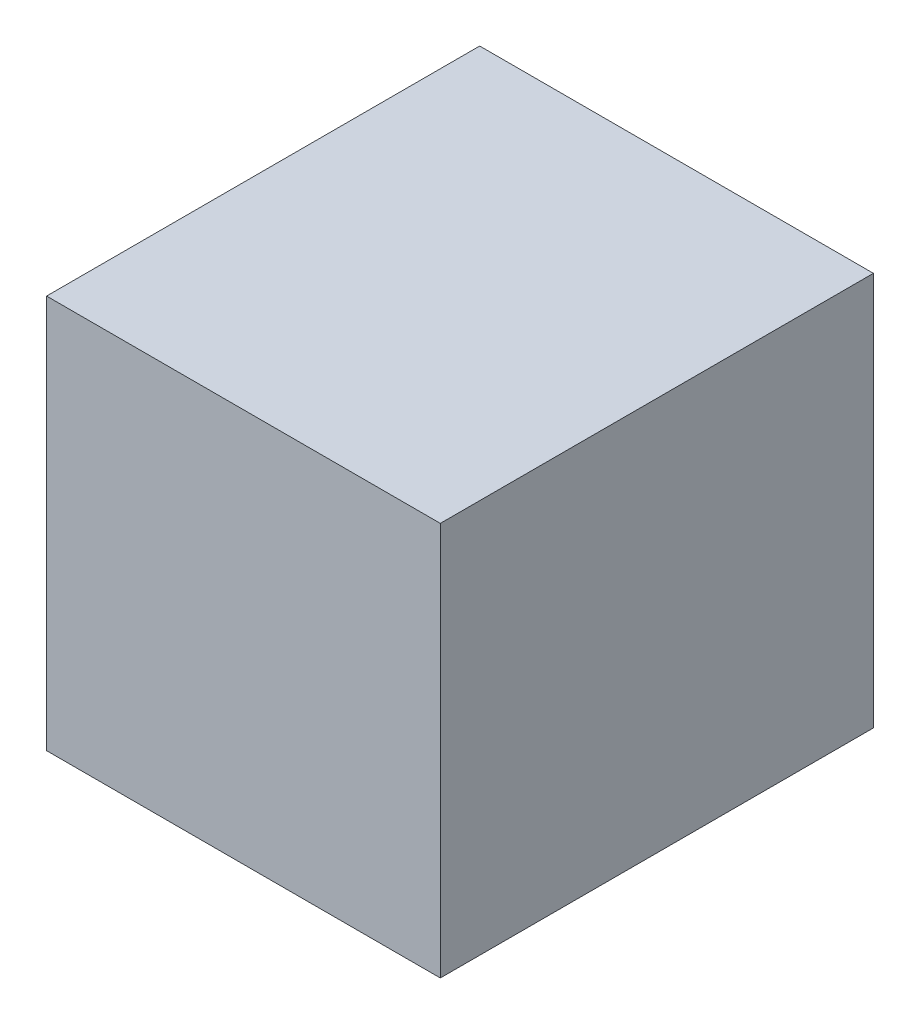
from build123d import *

# Parameters (mm, degrees)
SKETCH1_W   = 40
SKETCH1_H   = 40
BLOCK_DEPTH = 44
SKETCH4_W   = 3.5
SKETCH4_H   = 0.8


with BuildPart() as part:
    # Sketch1 → Block (new body)
    with BuildSketch(Plane(origin=(0, 0, 0), x_dir=(0, 1, 0), z_dir=(0, 0, 1))):
        Rectangle(SKETCH1_W, SKETCH1_H)
    extrude(amount=BLOCK_DEPTH)

    # Sketch2 → Hole (revolve, cut)
    with BuildSketch(Plane(origin=(0, 0, 0), x_dir=(-1, 0, 0), z_dir=(0, 1, 0))):
        Polygon((0, -0.5), (-4.3, -0.5), (-3.8, 0), (-3.4, 0.4), (-3.4, 36), (0, 36), align=None)
    revolve(axis=Axis((0, 0, -200), (0, 0, 1)), mode=Mode.SUBTRACT)

    # Sketch4 → InsertGroove (revolve, cut)
    with BuildSketch(Plane(origin=(0, 0, 0), x_dir=(-1, 0, 0), z_dir=(0, 1, 0))):
        with Locations((-5.75, -0.1)):
            Rectangle(SKETCH4_W, SKETCH4_H)
    revolve(axis=Axis((0, 0, -200), (0, 0, 1)), mode=Mode.SUBTRACT)


solid = part.part
